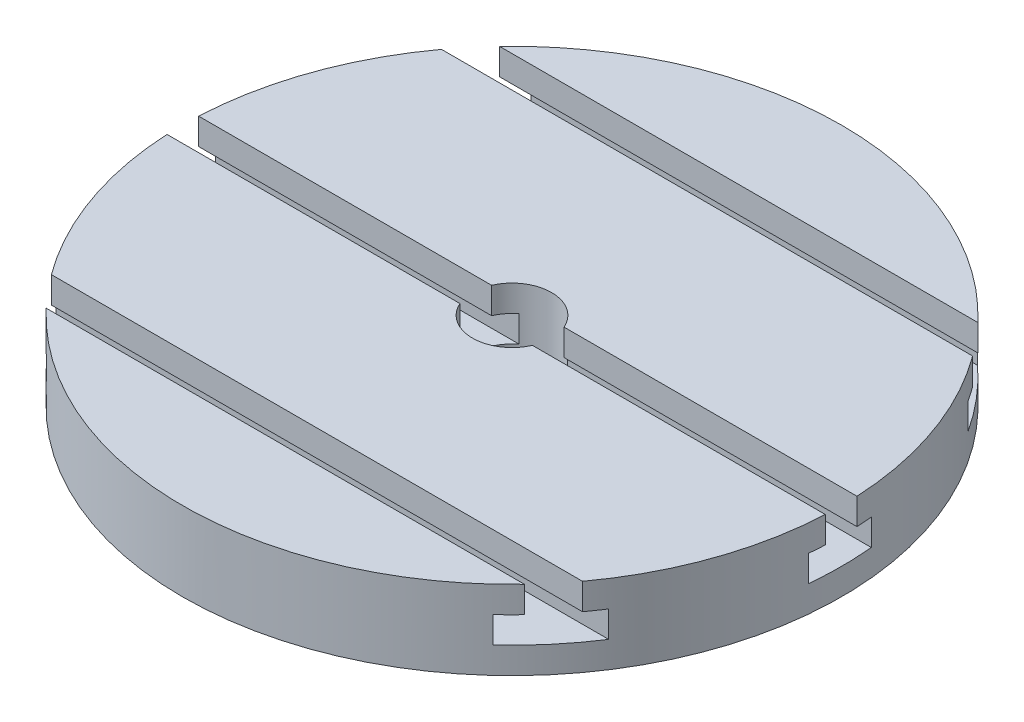
from build123d import *

# Parameters (mm, degrees)
SKETCH_1_W          = 110
SKETCH_1_H          = 30
CUT_EXTRUDE_1_DEPTH = 150


with BuildPart() as part:
    # Эскиз1 → Повернуть1 (revolve)
    with BuildSketch(Plane(origin=(0, 0, 0), x_dir=(0, 0, -1), z_dir=(1, 0, 0))):
        with Locations((70, 15)):
            Rectangle(SKETCH_1_W, SKETCH_1_H)
    revolve(axis=Axis((0, -12.628115938, 0), (0, 1, 0)))

    # Эскиз2 → Вырез-Вытянуть1 (cut, symmetric)
    with BuildSketch(Plane(origin=(0, 0, 0), x_dir=(0, 0, -1), z_dir=(1, 0, 0))):
        Polygon((11.873389283, 10), (11.873389283, 20), (6, 20), (6, 30), (-6, 30), (-6, 20), (-11.873389283, 20), (-11.873389283, 10), align=None)
        Polygon((68.126610717, 10), (91.873389283, 10), (91.873389283, 20), (86, 20), (86, 30), (74, 30), (74, 20), (68.126610717, 20), align=None)
        Polygon((-91.873389283, 10), (-68.126610717, 10), (-68.126610717, 20), (-74, 20), (-74, 30), (-86, 30), (-86, 20), (-91.873389283, 20), align=None)
    extrude(amount=CUT_EXTRUDE_1_DEPTH, both=True, mode=Mode.SUBTRACT)


solid = part.part
